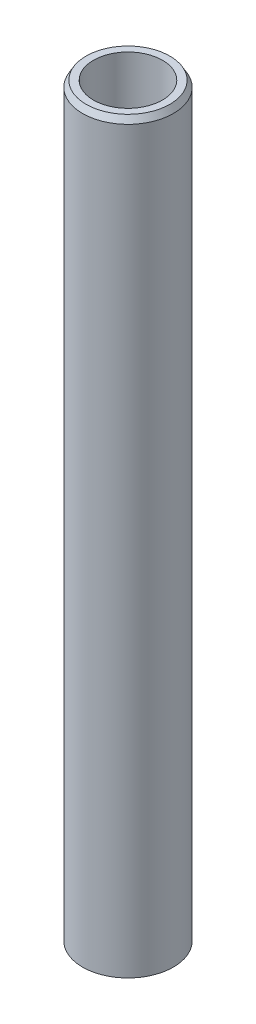
from build123d import *
from OCP.BRepFilletAPI import BRepFilletAPI_MakeChamfer

# Parameters (mm, degrees)
SKETCH1_R           = 35
BOSS_EXTRUDE1_DEPTH = 577.324740699
SKETCH2_R           = 26.612173243
CUT_EXTRUDE1_DEPTH  = 580.44271177
CHAMFER1_SIZE       = 4.75521389
CHAMFER1_SIZE2      = 2.745424019


with BuildPart() as part:
    # Sketch1 → Boss-Extrude1 (new body)
    with BuildSketch(Plane(origin=(0, 0, 0), x_dir=(1, 0, 0), z_dir=(0, 1, 0))):
        Circle(SKETCH1_R)
    extrude(amount=BOSS_EXTRUDE1_DEPTH)

    # Sketch2 → Cut-Extrude1 (cut, through all)
    with BuildSketch(Plane(origin=(0, 0, 0), x_dir=(1, 0, 0), z_dir=(0, 1, 0))):
        Circle(SKETCH2_R)
    extrude(amount=CUT_EXTRUDE1_DEPTH, mode=Mode.SUBTRACT)

    # Chamfer1: one chamfer whose edges measure the first distance from different faces: ONE call of the kernel's chamfer builder (chamfer() names one face for all edges)
    chamfer1_edges_1 = [part.edges().sort_by_distance(p)[0] for p in [
        (-35, 577.324740699, 0),
    ]]
    chamfer1_side_1 = [part.faces().sort_by_distance(p)[0] for p in [
        (-35, 288.66237035, 0),
    ]]
    chamfer1_edges_2 = [part.edges().sort_by_distance(p)[0] for p in [
        (-35, 0, 0),
    ]]
    chamfer1_side_2 = [part.faces().sort_by_distance(p)[0] for p in [
        (-34.010050506, 0, 0),
    ]]
    chamfer1 = BRepFilletAPI_MakeChamfer(part.part.solid().wrapped)
    for e in chamfer1_edges_1:
        chamfer1.Add(CHAMFER1_SIZE, CHAMFER1_SIZE2, e.wrapped, chamfer1_side_1[0].wrapped)  # the first distance lies on this face
    for e in chamfer1_edges_2:
        chamfer1.Add(CHAMFER1_SIZE, CHAMFER1_SIZE2, e.wrapped, chamfer1_side_2[0].wrapped)  # the first distance lies on this face
    add(Compound.cast(chamfer1.Shape()), mode=Mode.REPLACE)


solid = part.part
